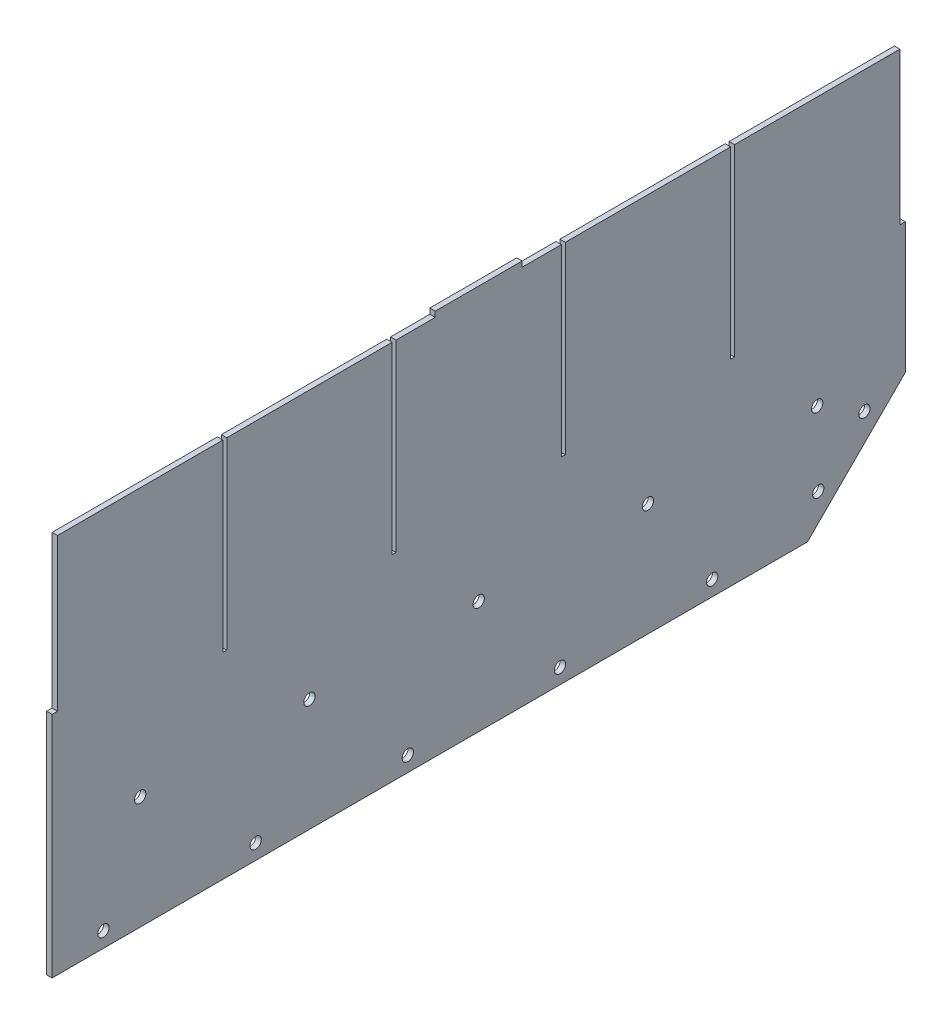
from build123d import *

# Parameters (mm, degrees)
SKETCH1_W            = 498.348
SKETCH1_H            = 165.1
BOSS_EXTRUDE1_DEPTH  = 1.5875
BOSS_EXTRUDE2_DEPTH  = 3.175
SKETCH3_R            = 3.302
CUT_EXTRUDE1_DEPTH   = 3.175
LPATTERN1_COUNT      = 5
LPATTERN1_PITCH      = 88.9
CUT_EXTRUDE2_DEPTH   = 286.681383539
LPATTERN2_COUNT      = 2
LPATTERN2_PITCH      = 38.1
SKETCH5_W            = 3.175
SKETCH5_H            = 88.9
CUT_EXTRUDE3_DEPTH   = 286.681383539
SKETCH6_W            = 2.286
SKETCH6_H            = 107.442
CUT_EXTRUDE4_DEPTH   = 286.681383539
LPATTERN3_COUNT      = 4
LPATTERN3_PITCH      = 98.8568
SKETCH7_W            = 50.8
SKETCH7_H            = 3.175
BOSS_EXTRUDE3_DEPTH  = 3.175
M6_CLEARANCE_HOLE1_D = 6.6
LPATTERN4_COUNT      = 3
LPATTERN4_PITCH      = 98.8568
LPATTERN4_COUNT_DIR2 = 3
LPATTERN4_PITCH_DIR2 = 98.8568


with BuildPart() as part:
    # Sketch1 → Boss-Extrude1 (new, symmetric)
    with BuildSketch(Plane(origin=(0, 0, 0), x_dir=(0, 0, -1), z_dir=(1, 0, 0))):
        Rectangle(SKETCH1_W, SKETCH1_H)
    extrude(amount=BOSS_EXTRUDE1_DEPTH, both=True)

    # Sketch2 → Boss-Extrude2 (add)
    with BuildSketch(Plane(origin=(1.5875, 0, 0), x_dir=(0, 0, -1), z_dir=(1, 0, 0))):
        Polygon((-249.174, -139.7), (192.024, -139.7), (249.174, -82.55), (-249.174, -82.55), align=None)
    extrude(amount=-BOSS_EXTRUDE2_DEPTH)

    # Sketch3 → Cut-Extrude1 (cut)
    with BuildSketch(Plane(origin=(1.5875, 0, 0), x_dir=(0, 0, -1), z_dir=(1, 0, 0))):
        with Locations((-219.202, -130.81)):
            Circle(SKETCH3_R)
    cut_extrude1 = extrude(amount=-CUT_EXTRUDE1_DEPTH, mode=Mode.SUBTRACT)

    # LPattern1: Cut-Extrude1 ×5
    with Locations(*[(0, 0, -i * LPATTERN1_PITCH) for i in range(1, LPATTERN1_COUNT)]):
        add(cut_extrude1, mode=Mode.SUBTRACT)

    # Sketch4 → Cut-Extrude2 (cut, through all)
    with BuildSketch(Plane(origin=(1.5875, 0, 0), x_dir=(0, 0, -1), z_dir=(1, 0, 0))):
        with BuildLine():
            ThreePointArc((195.975312693, -119.584226289), (199.573799978, -120.300009914), (201.612179285, -117.249359697))
            ThreePointArc((201.612179285, -117.249359697), (197.046558591, -114.198709481), (195.975312693, -119.584226289))
        make_face()
    cut_extrude2 = extrude(amount=-CUT_EXTRUDE2_DEPTH, mode=Mode.SUBTRACT)

    # LPattern2: Cut-Extrude2 ×2
    with Locations(*[Vector(0, 0.7071067811865489, -0.7071067811865461) * (i * LPATTERN2_PITCH) for i in range(1, LPATTERN2_COUNT)]):
        add(cut_extrude2, mode=Mode.SUBTRACT)

    # Sketch5 → Cut-Extrude3 (cut, through all)
    with BuildSketch(Plane.ZY.offset(1.5875)):
        with Locations((-247.5865, 38.1)):
            Rectangle(SKETCH5_W, SKETCH5_H)
        with Locations((247.5865, 38.1)):
            Rectangle(SKETCH5_W, SKETCH5_H)
    extrude(amount=-CUT_EXTRUDE3_DEPTH, mode=Mode.SUBTRACT)

    # Sketch6 → Cut-Extrude4 (cut, through all)
    with BuildSketch(Plane.ZY.offset(1.5875)):
        with Locations((-148.2852, 28.829)):
            Rectangle(SKETCH6_W, SKETCH6_H)
    cut_extrude4 = extrude(amount=-CUT_EXTRUDE4_DEPTH, mode=Mode.SUBTRACT)

    # LPattern3: Cut-Extrude4 ×4
    with Locations(*[(0, 0, i * LPATTERN3_PITCH) for i in range(1, LPATTERN3_COUNT)]):
        add(cut_extrude4, mode=Mode.SUBTRACT)

    # Sketch7 → Boss-Extrude3 (add)
    with BuildSketch(Plane.ZY.offset(1.5875)):
        with Locations((0, 84.1375)):
            Rectangle(SKETCH7_W, SKETCH7_H)
    extrude(amount=-BOSS_EXTRUDE3_DEPTH)

    # M6 Clearance Hole1 (through all)
    with Locations(Plane(origin=(1.5875, 0, 0), x_dir=(0, 0, -1), z_dir=(1, 0, 0))):
        with Locations((0, -73.8124)):
            m6_clearance_hole1 = Hole(M6_CLEARANCE_HOLE1_D / 2)

    # LPattern4: M6 Clearance Hole1 3 × 3
    with Locations(*[Vector(0, 0, 1) * (i * LPATTERN4_PITCH) + Vector(0, 0, -1) * (j * LPATTERN4_PITCH_DIR2) for i in range(LPATTERN4_COUNT) for j in range(LPATTERN4_COUNT_DIR2) if (i, j) != (0, 0)]):
        add(m6_clearance_hole1, mode=Mode.SUBTRACT)


solid = part.part
